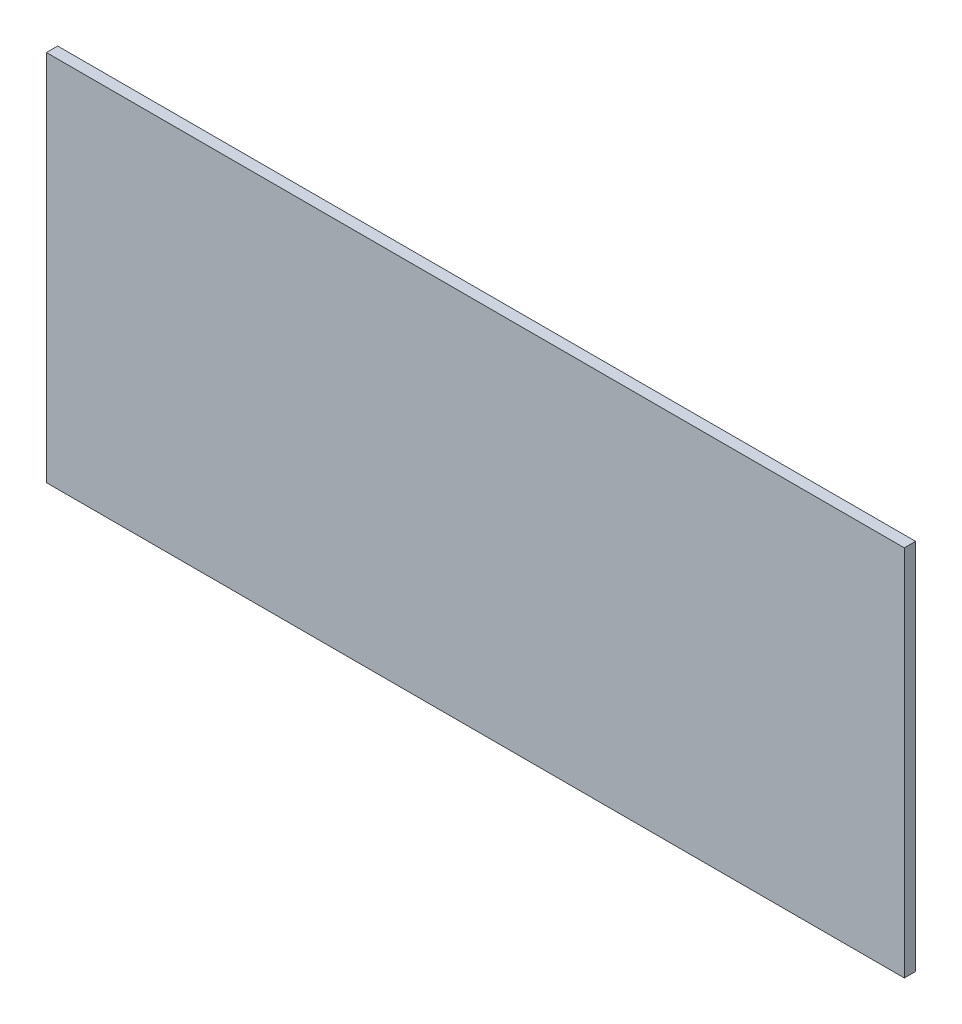
from build123d import *

# Parameters (mm, degrees)
ESQUISSE1_W        = 380
ESQUISSE1_H        = 165
BOSS_EXTRU_1_DEPTH = 5


with BuildPart() as part:
    # Esquisse1 → Boss.-Extru.1 (new body)
    with BuildSketch(Plane.XY):
        with Locations((-18.46713993, -30.669642857)):
            Rectangle(ESQUISSE1_W, ESQUISSE1_H)
    extrude(amount=BOSS_EXTRU_1_DEPTH)


solid = part.part
